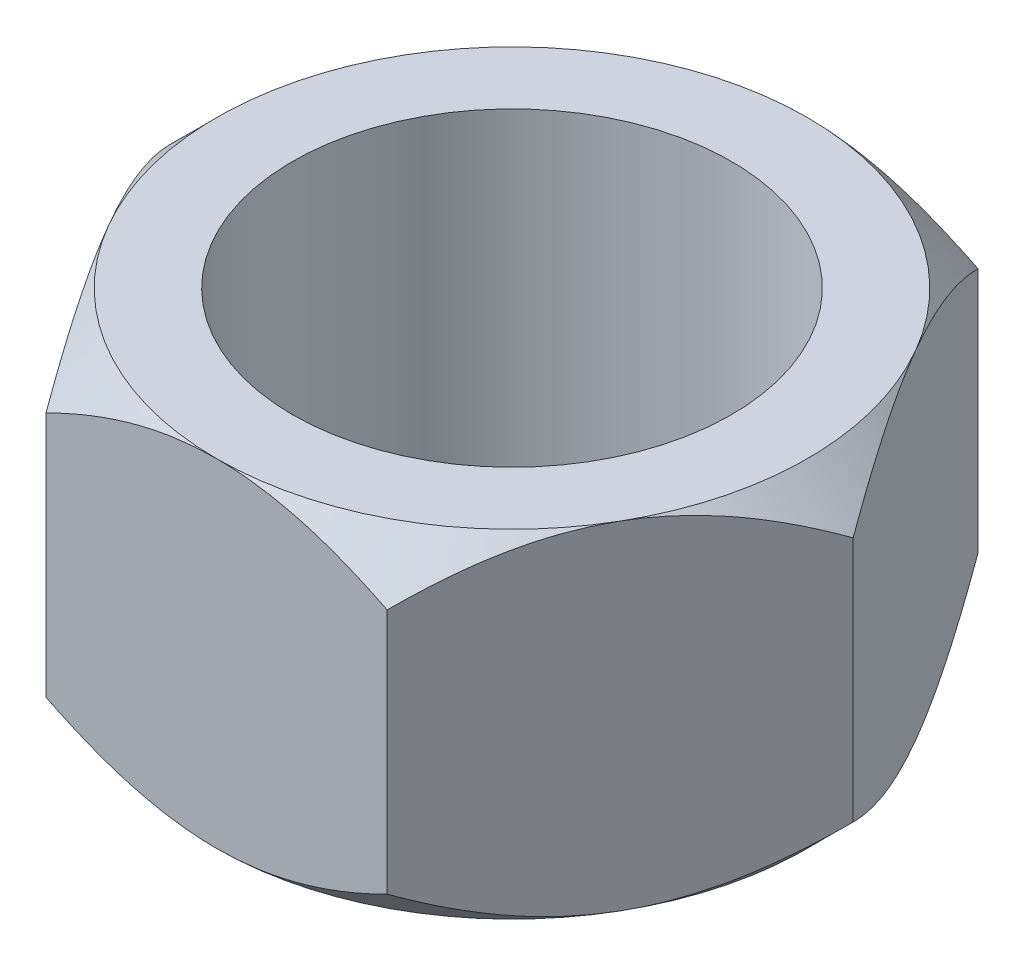
from build123d import *

# Parameters (mm, degrees)
SKETCH1_R           = 3.302
BOSS_EXTRUDE1_DEPTH = 2.54


# Read off the part's stored shape, not the designer's step: Cut-Extrude1
with BuildPart() as part:
    # Sketch1 → Boss-Extrude1 (new, symmetric)
    with BuildSketch(Plane(origin=(0, 0, 0), x_dir=(1, 0, 0), z_dir=(0, 1, 0))):
        Polygon((5.132643893, 0), (2.566321947, 4.445), (-2.566321947, 4.445), (-5.132643893, 0), (-2.566321947, -4.445), (2.566321947, -4.445), align=None)
        with Locations(Location((0, 0, 0), (0, 0, 270))):
            Circle(SKETCH1_R, mode=Mode.SUBTRACT)
    extrude(amount=BOSS_EXTRUDE1_DEPTH, both=True)

    # Cut-Extrude1 outline → Cut-Extrude1 (revolve, cut)
    with BuildSketch(Plane.XY):
        Polygon((5.132643901, 2.540000192), (4.444999936, 2.540000192), (5.132643898, 1.852356102), align=None)
    cut_extrude1 = revolve(axis=Axis((0, 0, 0), (0, 1, 0)), mode=Mode.SUBTRACT)

    # Mirror1: Cut-Extrude1 across plane
    add(cut_extrude1.mirror(Plane.ZX), mode=Mode.SUBTRACT)


solid = part.part
